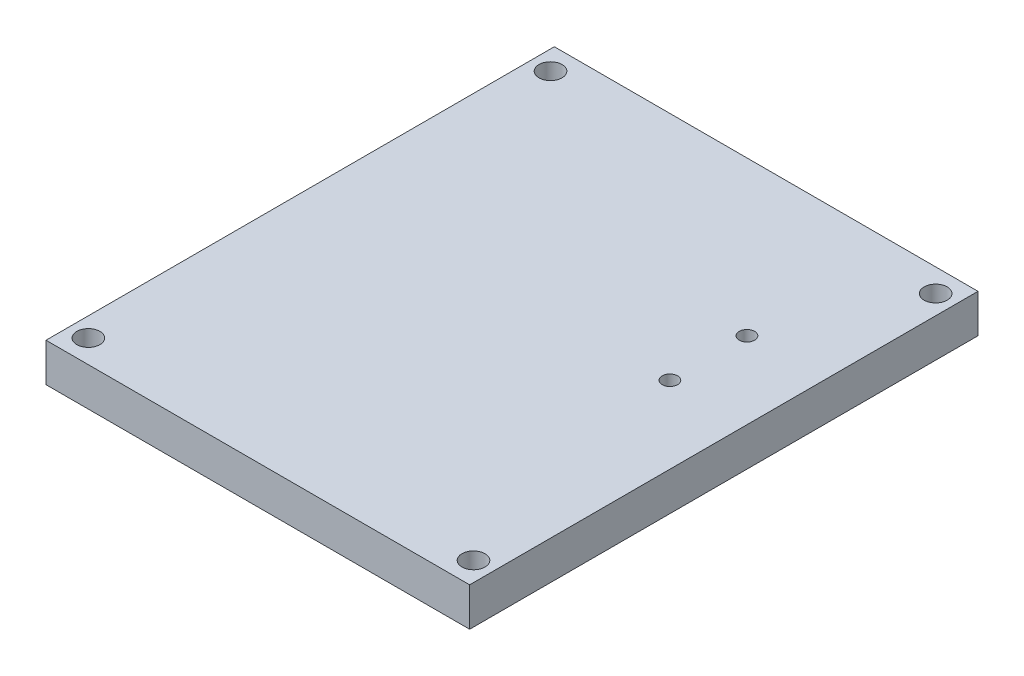
from build123d import *

# Parameters (mm, degrees)
ESQUISSE1_W        = 55
ESQUISSE1_H        = 66
ESQUISSE1_R        = 1.5
ESQUISSE1_R_2      = 1
BOSS_EXTRU_1_DEPTH = 5


with BuildPart() as part:
    # Esquisse1 → Boss.-Extru.1 (new body)
    with BuildSketch(Plane(origin=(0, 0, 0), x_dir=(1, 0, 0), z_dir=(0, 1, 0))):
        with Locations((-0.039557044, -0.082747187)):
            Rectangle(ESQUISSE1_W, ESQUISSE1_H)
        with Locations((-25.039557044, 29.917252813)):
            Circle(ESQUISSE1_R, mode=Mode.SUBTRACT)
        with Locations((24.960442956, 29.917252813)):
            Circle(ESQUISSE1_R, mode=Mode.SUBTRACT)
        with Locations((24.960442956, -30.082747187)):
            Circle(ESQUISSE1_R, mode=Mode.SUBTRACT)
        with Locations((-25.039557044, -30.082747187)):
            Circle(ESQUISSE1_R, mode=Mode.SUBTRACT)
        with Locations((17.460442956, 12.917252813)):
            Circle(ESQUISSE1_R_2, mode=Mode.SUBTRACT)
        with Locations((17.460442956, 2.917252813)):
            Circle(ESQUISSE1_R_2, mode=Mode.SUBTRACT)
    extrude(amount=BOSS_EXTRU_1_DEPTH)


solid = part.part
